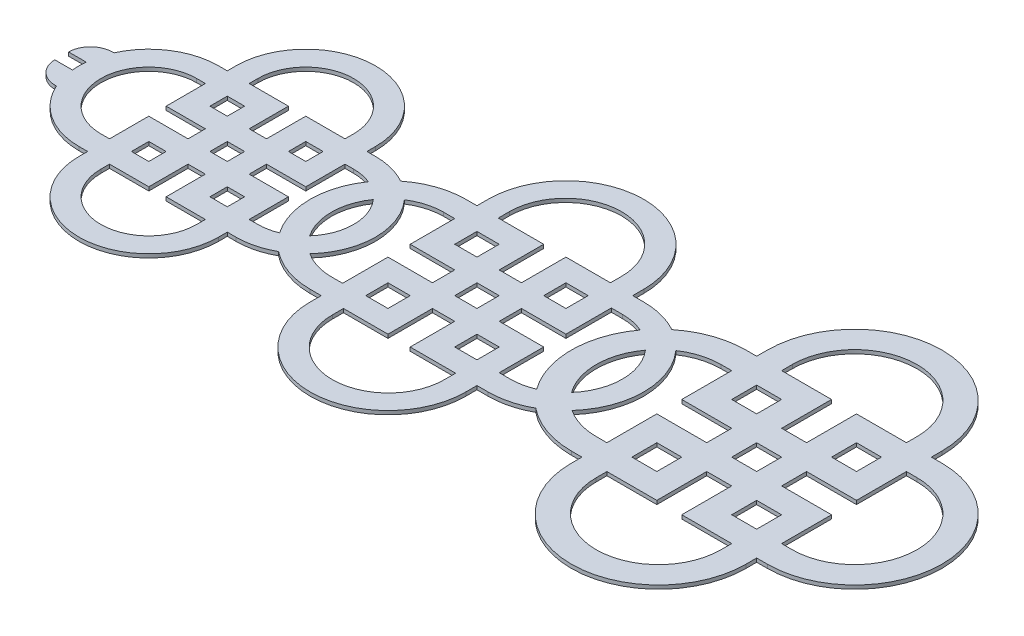
from build123d import *

# Parameters (mm, degrees)
SKETCH_2_W      = 1.188571429
SKETCH_2_H      = 1.188571429
SKETCH_2_W_2    = 1.188571428
SKETCH_2_H_2    = 1.188571428
EXTRUDE_1_DEPTH = 0.254
SKETCH_5_W      = 1.524
SKETCH_5_H      = 1.524
EXTRUDE_4_DEPTH = 0.254
SKETCH_6_W      = 1.709962663
SKETCH_6_H      = 1.709962664
SKETCH_6_W_2    = 1.709962664
SKETCH_6_H_2    = 1.709962663
EXTRUDE_5_DEPTH = 0.254
EXTRUDE_START   = -0.254
EXTRUDE_6_DEPTH = 0.254
FILLET_1_R      = 1.524


with BuildPart() as part:
    # 스케치2 → 보스-돌출1 (new body)
    with BuildSketch(Plane(origin=(0, 0, 0), x_dir=(1, 0, 0), z_dir=(0, 1, 0))):
        with BuildLine():
            Line((-46.017142857, 4.782857143), (-45.422857143, 4.782857143))
            Line((-45.422857143, 4.782857143), (-45.422857143, 5.377142857))
            ThreePointArc((-45.422857143, 5.377142857), (-40.64, 10.16), (-35.857142857, 5.377142857))
            Line((-35.857142857, 5.377142857), (-35.857142857, 4.782857143))
            Line((-35.857142857, 4.782857143), (-35.262857143, 4.782857143))
            ThreePointArc((-35.262857143, 4.782857143), (-30.48, 0), (-35.262857143, -4.782857143))
            Line((-35.262857143, -4.782857143), (-35.857142857, -4.782857143))
            Line((-35.857142857, -4.782857143), (-35.857142857, -5.377142857))
            ThreePointArc((-35.857142857, -5.377142857), (-40.64, -10.16), (-45.422857143, -5.377142857))
            Line((-45.422857143, -5.377142857), (-45.422857143, -4.782857143))
            Line((-45.422857143, -4.782857143), (-46.017142857, -4.782857143))
            ThreePointArc((-46.017142857, -4.782857143), (-50.8, 0), (-46.017142857, 4.782857143))
        make_face()
        with BuildLine():
            Line((-37.357142857, 5.377142857), (-37.357142857, 4.782857143))
            Line((-37.357142857, 4.782857143), (-40.045714286, 4.782857143))
            Line((-40.045714286, 4.782857143), (-40.045714286, 2.094285714))
            Line((-40.045714286, 2.094285714), (-41.234285714, 2.094285714))
            Line((-41.234285714, 2.094285714), (-41.234285714, 4.782857143))
            Line((-41.234285714, 4.782857143), (-43.922857143, 4.782857143))
            Line((-43.922857143, 4.782857143), (-43.922857143, 5.377142857))
            ThreePointArc((-43.922857143, 5.377142857), (-40.64, 8.66), (-37.357142857, 5.377142857))
        make_face(mode=Mode.SUBTRACT)
        with BuildLine():
            Line((-35.262857143, -3.282857143), (-35.857142857, -3.282857143))
            Line((-35.857142857, -3.282857143), (-35.857142857, -0.594285714))
            Line((-35.857142857, -0.594285714), (-38.545714286, -0.594285714))
            Line((-38.545714286, -0.594285714), (-38.545714286, 0.594285714))
            Line((-38.545714286, 0.594285714), (-35.857142857, 0.594285714))
            Line((-35.857142857, 0.594285714), (-35.857142857, 3.282857143))
            Line((-35.857142857, 3.282857143), (-35.262857143, 3.282857143))
            ThreePointArc((-35.262857143, 3.282857143), (-31.98, 0), (-35.262857143, -3.282857143))
        make_face(mode=Mode.SUBTRACT)
        with Locations((-43.328571428, 2.688571429)):
            Rectangle(SKETCH_2_W, SKETCH_2_H, mode=Mode.SUBTRACT)
        with Locations((-40.64, 0)):
            Rectangle(SKETCH_2_W_2, SKETCH_2_H_2, mode=Mode.SUBTRACT)
        with Locations((-43.328571428, -2.688571429)):
            Rectangle(SKETCH_2_W, SKETCH_2_H, mode=Mode.SUBTRACT)
        with Locations((-37.951428572, -2.688571429)):
            Rectangle(SKETCH_2_W, SKETCH_2_H, mode=Mode.SUBTRACT)
        with Locations((-37.951428572, 2.688571429)):
            Rectangle(SKETCH_2_W, SKETCH_2_H, mode=Mode.SUBTRACT)
        with BuildLine():
            Line((-46.017142857, 3.282857143), (-45.422857143, 3.282857143))
            Line((-45.422857143, 3.282857143), (-45.422857143, 0.594285714))
            Line((-45.422857143, 0.594285714), (-42.734285714, 0.594285714))
            Line((-42.734285714, 0.594285714), (-42.734285714, -0.594285714))
            Line((-42.734285714, -0.594285714), (-45.422857143, -0.594285714))
            Line((-45.422857143, -0.594285714), (-45.422857143, -3.282857143))
            Line((-45.422857143, -3.282857143), (-46.017142857, -3.282857143))
            ThreePointArc((-46.017142857, -3.282857143), (-49.3, 0), (-46.017142857, 3.282857143))
        make_face(mode=Mode.SUBTRACT)
        with BuildLine():
            Line((-43.922857143, -4.782857143), (-41.234285714, -4.782857143))
            Line((-41.234285714, -4.782857143), (-41.234285714, -2.094285714))
            Line((-41.234285714, -2.094285714), (-40.045714286, -2.094285714))
            Line((-40.045714286, -2.094285714), (-40.045714286, -4.782857143))
            Line((-40.045714286, -4.782857143), (-37.357142857, -4.782857143))
            Line((-37.357142857, -4.782857143), (-37.357142857, -5.377142857))
            ThreePointArc((-37.357142857, -5.377142857), (-40.64, -8.66), (-43.922857143, -5.377142857))
            Line((-43.922857143, -5.377142857), (-43.922857143, -4.782857143))
        make_face(mode=Mode.SUBTRACT)
    extrude(amount=EXTRUDE_1_DEPTH)

    # 스케치5 → 보스-돌출4 (add)
    with BuildSketch(Plane(origin=(0, 0.254, 0), x_dir=(1, 0, 0), z_dir=(0, 1, 0))):
        with BuildLine():
            Line((-28.869714286, 5.334), (-28.869714286, 6.096))
            ThreePointArc((-28.869714286, 6.096), (-23.535714286, 11.43), (-18.201714286, 6.096))
            Line((-18.201714286, 6.096), (-18.201714286, 5.334))
            Line((-18.201714286, 5.334), (-17.439714286, 5.334))
            ThreePointArc((-17.439714286, 5.334), (-12.105714286, 0), (-17.439714286, -5.334))
            Line((-17.439714286, -5.334), (-18.201714286, -5.334))
            Line((-18.201714286, -5.334), (-18.201714286, -6.096))
            ThreePointArc((-18.201714286, -6.096), (-23.535714286, -11.43), (-28.869714286, -6.096))
            Line((-28.869714286, -6.096), (-28.869714286, -5.334))
            Line((-28.869714286, -5.334), (-29.631714286, -5.334))
            ThreePointArc((-29.631714286, -5.334), (-34.965714286, 0), (-29.631714286, 5.334))
            Line((-29.631714286, 5.334), (-28.869714286, 5.334))
        make_face()
        with Locations((-23.535714286, 0)):
            Rectangle(SKETCH_5_W, SKETCH_5_H, mode=Mode.SUBTRACT)
        with Locations((-26.583714286, 3.048)):
            Rectangle(SKETCH_5_W, SKETCH_5_H, mode=Mode.SUBTRACT)
        with BuildLine():
            Line((-28.869714286, 3.81), (-28.869714286, 0.762))
            Line((-28.869714286, 0.762), (-25.821714286, 0.762))
            Line((-25.821714286, 0.762), (-25.821714286, -0.762))
            Line((-25.821714286, -0.762), (-28.869714286, -0.762))
            Line((-28.869714286, -0.762), (-28.869714286, -3.870990001))
            Line((-28.869714286, -3.870990001), (-29.631714286, -3.870990001))
            ThreePointArc((-29.631714286, -3.870990001), (-33.472209286, -0.030495), (-29.631714286, 3.81))
            Line((-29.631714286, 3.81), (-28.869714286, 3.81))
        make_face(mode=Mode.SUBTRACT)
        with BuildLine():
            Line((-19.725714286, 5.334), (-22.773714286, 5.334))
            Line((-22.773714286, 5.334), (-22.773714286, 2.286))
            Line((-22.773714286, 2.286), (-24.297714286, 2.286))
            Line((-24.297714286, 2.286), (-24.297714286, 5.334))
            Line((-24.297714286, 5.334), (-27.406704287, 5.334))
            Line((-27.406704287, 5.334), (-27.406704287, 6.096))
            ThreePointArc((-27.406704287, 6.096), (-23.566209286, 9.936495), (-19.725714286, 6.096))
            Line((-19.725714286, 6.096), (-19.725714286, 5.334))
        make_face(mode=Mode.SUBTRACT)
        with Locations((-20.487714286, 3.048)):
            Rectangle(SKETCH_5_W, SKETCH_5_H, mode=Mode.SUBTRACT)
        with Locations((-20.487714286, -3.048)):
            Rectangle(SKETCH_5_W, SKETCH_5_H, mode=Mode.SUBTRACT)
        with Locations((-26.583714286, -3.048)):
            Rectangle(SKETCH_5_W, SKETCH_5_H, mode=Mode.SUBTRACT)
        with BuildLine():
            Line((-18.201714286, -3.81), (-18.201714286, -0.762))
            Line((-18.201714286, -0.762), (-21.249714286, -0.762))
            Line((-21.249714286, -0.762), (-21.249714286, 0.762))
            Line((-21.249714286, 0.762), (-18.201714286, 0.762))
            Line((-18.201714286, 0.762), (-18.201714286, 3.870990001))
            Line((-18.201714286, 3.870990001), (-17.439714286, 3.870990001))
            ThreePointArc((-17.439714286, 3.870990001), (-13.599219285, 0.030495), (-17.439714286, -3.81))
            Line((-17.439714286, -3.81), (-18.201714286, -3.81))
        make_face(mode=Mode.SUBTRACT)
        with BuildLine():
            Line((-27.345714286, -5.334), (-24.297714286, -5.334))
            Line((-24.297714286, -5.334), (-24.297714286, -2.286))
            Line((-24.297714286, -2.286), (-22.773714286, -2.286))
            Line((-22.773714286, -2.286), (-22.773714286, -5.334))
            Line((-22.773714286, -5.334), (-19.664724285, -5.334))
            Line((-19.664724285, -5.334), (-19.664724285, -6.096))
            ThreePointArc((-19.664724285, -6.096), (-23.505219285, -9.936495), (-27.345714286, -6.096))
            Line((-27.345714286, -6.096), (-27.345714286, -5.334))
        make_face(mode=Mode.SUBTRACT)
    extrude(amount=-EXTRUDE_4_DEPTH)

    # 스케치6 → 보스-돌출5 (add)
    with BuildSketch(Plane(origin=(0, 0.254, 0), x_dir=(1, 0, 0), z_dir=(0, 1, 0))):
        with BuildLine():
            Line((-10.359452928, 5.984869321), (-10.359452928, 6.715130679))
            ThreePointArc((-10.359452928, 6.715130679), (-4.374583607, 12.7), (1.610285714, 6.715130679))
            Line((1.610285714, 6.715130679), (1.610285714, 5.984869321))
            Line((1.610285714, 5.984869321), (2.340547072, 5.984869321))
            ThreePointArc((2.340547072, 5.984869321), (8.325416393, 0), (2.340547072, -5.984869321))
            Line((2.340547072, -5.984869321), (1.610285714, -5.984869321))
            Line((1.610285714, -5.984869321), (1.610285714, -6.715130679))
            ThreePointArc((1.610285714, -6.715130679), (-4.374583607, -12.7), (-10.359452928, -6.715130679))
            Line((-10.359452928, -6.715130679), (-10.359452928, -5.984869321))
            Line((-10.359452928, -5.984869321), (-11.089714286, -5.984869321))
            ThreePointArc((-11.089714286, -5.984869321), (-17.074583607, 0), (-11.089714286, 5.984869321))
            Line((-11.089714286, 5.984869321), (-10.359452928, 5.984869321))
        make_face()
        with Locations((-4.374583606, 0)):
            Rectangle(SKETCH_6_W, SKETCH_6_H, mode=Mode.SUBTRACT)
        with Locations((-7.794508933, 3.419925327)):
            Rectangle(SKETCH_6_W_2, SKETCH_6_H_2, mode=Mode.SUBTRACT)
        with BuildLine():
            Line((-10.359452928, 4.274906658), (-11.089714286, 4.274906658))
            ThreePointArc((-11.089714286, 4.274906658), (-15.364620944, 0), (-11.089714286, -4.274906658))
            Line((-11.089714286, -4.274906658), (-10.359452928, -4.274906658))
            Line((-10.359452928, -4.274906658), (-10.359452928, -0.854981332))
            Line((-10.359452928, -0.854981332), (-6.939527601, -0.854981332))
            Line((-6.939527601, -0.854981332), (-6.939527601, 0.854981332))
            Line((-6.939527601, 0.854981332), (-10.359452928, 0.854981332))
            Line((-10.359452928, 0.854981332), (-10.359452928, 4.274906658))
        make_face(mode=Mode.SUBTRACT)
        with Locations((-0.954658281, 3.419925327)):
            Rectangle(SKETCH_6_W, SKETCH_6_H_2, mode=Mode.SUBTRACT)
        with Locations((-0.954658281, -3.419925327)):
            Rectangle(SKETCH_6_W, SKETCH_6_H_2, mode=Mode.SUBTRACT)
        with Locations((-7.794508933, -3.419925327)):
            Rectangle(SKETCH_6_W_2, SKETCH_6_H_2, mode=Mode.SUBTRACT)
        with BuildLine():
            Line((-5.229564938, 5.984869321), (-8.649490265, 5.984869321))
            Line((-8.649490265, 5.984869321), (-8.649490265, 6.715130679))
            ThreePointArc((-8.649490265, 6.715130679), (-4.374583607, 10.990037337), (-0.099676949, 6.715130679))
            Line((-0.099676949, 6.715130679), (-0.099676949, 5.984869321))
            Line((-0.099676949, 5.984869321), (-3.519602275, 5.984869321))
            Line((-3.519602275, 5.984869321), (-3.519602275, 2.564943995))
            Line((-3.519602275, 2.564943995), (-5.229564938, 2.564943995))
            Line((-5.229564938, 2.564943995), (-5.229564938, 5.984869321))
        make_face(mode=Mode.SUBTRACT)
        with BuildLine():
            Line((1.610285714, 0.854981332), (1.610285714, 4.274906658))
            Line((1.610285714, 4.274906658), (2.340547072, 4.274906658))
            ThreePointArc((2.340547072, 4.274906658), (6.61545373, 0), (2.340547072, -4.274906658))
            Line((2.340547072, -4.274906658), (1.610285714, -4.274906658))
            Line((1.610285714, -4.274906658), (1.610285714, -0.854981332))
            Line((1.610285714, -0.854981332), (-1.809639612, -0.854981332))
            Line((-1.809639612, -0.854981332), (-1.809639612, 0.854981332))
            Line((-1.809639612, 0.854981332), (1.610285714, 0.854981332))
        make_face(mode=Mode.SUBTRACT)
        with BuildLine():
            Line((-3.519602275, -5.984869321), (-0.099676949, -5.984869321))
            Line((-0.099676949, -5.984869321), (-0.099676949, -6.715130679))
            ThreePointArc((-0.099676949, -6.715130679), (-4.374583607, -10.990037337), (-8.649490265, -6.715130679))
            Line((-8.649490265, -6.715130679), (-8.649490265, -5.984869321))
            Line((-8.649490265, -5.984869321), (-5.229564938, -5.984869321))
            Line((-5.229564938, -5.984869321), (-5.229564938, -2.564943995))
            Line((-5.229564938, -2.564943995), (-3.519602275, -2.564943995))
            Line((-3.519602275, -2.564943995), (-3.519602275, -5.984869321))
        make_face(mode=Mode.SUBTRACT)
    extrude(amount=-EXTRUDE_5_DEPTH)

    # 스케치7 → 보스-돌출6 (add)
    with BuildSketch(Plane(origin=(0, 0.254, 0), x_dir=(1, 0, 0), z_dir=(0, 1, 0)).offset(EXTRUDE_START)):
        with BuildLine():
            Line((-51.983351089, 0.47), (-51.983351089, 1.97))
            Line((-51.983351089, 1.97), (-50.375447854, 1.97))
            ThreePointArc((-50.375447854, 1.97), (-50.637428704, 1.236398455), (-50.776851089, 0.47))
            Line((-50.776851089, 0.47), (-51.983351089, 0.47))
        make_face()
        with BuildLine():
            Line((-51.983351089, -1.97), (-50.375447854, -1.97))
            ThreePointArc((-50.375447854, -1.97), (-50.637428704, -1.236398455), (-50.776851089, -0.47))
            Line((-50.776851089, -0.47), (-51.983351089, -0.47))
            Line((-51.983351089, -0.47), (-51.983351089, -1.97))
        make_face()
    extrude(amount=EXTRUDE_6_DEPTH)

    # 필렛1
    # the kernel refuses this fillet: 1.524 mm, written as the material it takes off along each edge
    with BuildSketch(Plane(origin=(-51.983351089, -3.81, 1.97), x_dir=(1, 0, 0), z_dir=(0, 1, 0)), Plane(origin=(-51.983351089, -3.81, -1.97), x_dir=(0, 0, 1), z_dir=(0, 1, 0))) as fillet_1_piece_1:
        with BuildLine():
            CenterArc((FILLET_1_R, FILLET_1_R), FILLET_1_R, 180, 90)
            Line((0, FILLET_1_R), (0, 0))
            Line((0, 0), (FILLET_1_R, 0))
        make_face()
    extrude(amount=7.874, mode=Mode.SUBTRACT)


solid = part.part
